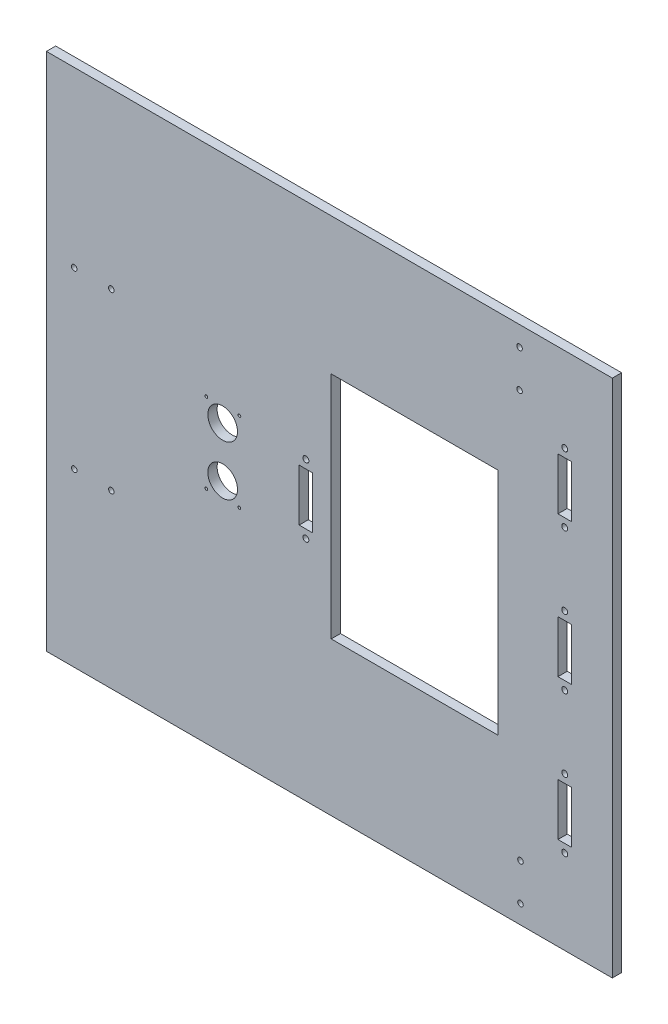
from build123d import *

# Parameters (mm, degrees)
ESQUISSE1_W             = 305
ESQUISSE1_H             = 280
BOSS_EXTRU_1_DEPTH      = 5
ESQUISSE2_W             = 90
ESQUISSE2_H             = 123.7
ENL_V_MAT_EXTRU_1_DEPTH = 5
ESQUISSE3_R             = 1.5
ENL_V_MAT_EXTRU_2_DEPTH = 415.065212255
ESQUISSE4_R             = 1.6
ESQUISSE4_W             = 7.3
ESQUISSE4_H             = 28
ENL_V_MAT_EXTRU_3_DEPTH = 415.065212255
ESQUISSE5_R             = 8
ESQUISSE5_R_2           = 0.75
ENL_V_MAT_EXTRU_4_DEPTH = 415.065212255


with BuildPart() as part:
    # Esquisse1 → Boss.-Extru.1 (new body)
    with BuildSketch(Plane.XY):
        with Locations((152.5, 140)):
            Rectangle(ESQUISSE1_W, ESQUISSE1_H)
    extrude(amount=BOSS_EXTRU_1_DEPTH)

    # Esquisse2 → Enlèv. mat.-Extru.1 (cut)
    with BuildSketch(Plane.XY.offset(5)):
        with Locations((198.5, 144.37)):
            Rectangle(ESQUISSE2_W, ESQUISSE2_H)
    extrude(amount=-ENL_V_MAT_EXTRU_1_DEPTH, mode=Mode.SUBTRACT)

    # Esquisse3 → Enlèv. mat.-Extru.2 (cut, through all)
    with BuildSketch(Plane(origin=(0, 0, 0), x_dir=(-1, 0, 0), z_dir=(0, 0, -1))):
        with Locations((-15, 92.5)):
            Circle(ESQUISSE3_R)
        with Locations((-35, 92.5)):
            Circle(ESQUISSE3_R)
        with Locations((-35, 186.5)):
            Circle(ESQUISSE3_R)
        with Locations((-15, 186.5)):
            Circle(ESQUISSE3_R)
        with Locations((-255, 249.4)):
            Circle(ESQUISSE3_R)
        with Locations((-255, 269.4)):
            Circle(ESQUISSE3_R)
        with Locations((-255.5, 10)):
            Circle(ESQUISSE3_R)
        with Locations((-255.5, 30)):
            Circle(ESQUISSE3_R)
    extrude(amount=-ENL_V_MAT_EXTRU_2_DEPTH, mode=Mode.SUBTRACT)

    # Esquisse4 → Enlèv. mat.-Extru.3 (cut, through all)
    with BuildSketch(Plane.XY.offset(5)):
        with Locations((139.85, 159.5)):
            Circle(ESQUISSE4_R)
        with Locations((139.85, 122.5)):
            Circle(ESQUISSE4_R)
        with Locations((279.35, 82.5)):
            Circle(ESQUISSE4_R)
        with Locations((279.35, 45.5)):
            Circle(ESQUISSE4_R)
        with Locations((279.35, 121.5)):
            Circle(ESQUISSE4_R)
        with Locations((279.35, 158.5)):
            Circle(ESQUISSE4_R)
        with Locations((279.35, 197.5)):
            Circle(ESQUISSE4_R)
        with Locations((279.35, 234.5)):
            Circle(ESQUISSE4_R)
        with Locations((279.35, 64)):
            Rectangle(ESQUISSE4_W, ESQUISSE4_H)
        with Locations((279.35, 140)):
            Rectangle(ESQUISSE4_W, ESQUISSE4_H)
        with Locations((279.35, 216)):
            Rectangle(ESQUISSE4_W, ESQUISSE4_H)
        with Locations((139.85, 141)):
            Rectangle(ESQUISSE4_W, ESQUISSE4_H)
    extrude(amount=-ENL_V_MAT_EXTRU_3_DEPTH, mode=Mode.SUBTRACT)

    # Esquisse5 → Enlèv. mat.-Extru.4 (cut, through all)
    with BuildSketch(Plane.XY.offset(5)):
        with Locations((95, 127)):
            Circle(ESQUISSE5_R)
        with Locations((95, 154)):
            Circle(ESQUISSE5_R)
        with Locations((86.2, 162)):
            Circle(ESQUISSE5_R_2)
        with Locations((104, 162)):
            Circle(ESQUISSE5_R_2)
        with Locations((104, 119)):
            Circle(ESQUISSE5_R_2)
        with Locations((86.2, 119)):
            Circle(ESQUISSE5_R_2)
    extrude(amount=-ENL_V_MAT_EXTRU_4_DEPTH, mode=Mode.SUBTRACT)


solid = part.part
